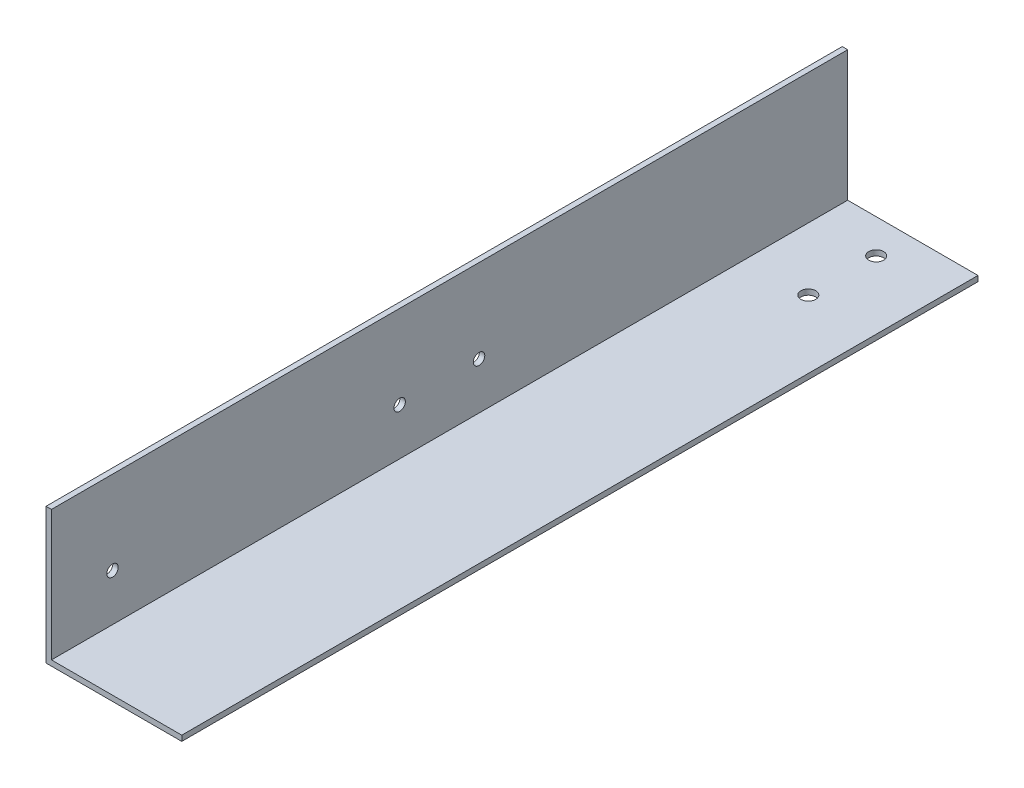
from build123d import *

# Parameters (mm, degrees)
BOSS_EXTRUDE1_DEPTH = 293.25
SKETCH2_R           = 2.1
CUT_EXTRUDE1_DEPTH  = 5
SKETCH3_R           = 2.75
CUT_EXTRUDE2_DEPTH  = 5


with BuildPart() as part:
    # Sketch1 → Boss-Extrude1 (new body)
    with BuildSketch(Plane.XY):
        Polygon((0, 0), (50, 0), (50, 2), (2, 2), (2, 50), (0, 50), align=None)
    extrude(amount=BOSS_EXTRUDE1_DEPTH)

    # Sketch2 → Cut-Extrude1 (cut, symmetric)
    with BuildSketch(Plane(origin=(0, 0, 0), x_dir=(0, 0, -1), z_dir=(1, 0, 0))):
        with Locations((-135.75, 19.25)):
            Circle(SKETCH2_R)
        with Locations((-165, 19.25)):
            Circle(SKETCH2_R)
        with Locations((-270.75, 19.25)):
            Circle(SKETCH2_R)
    extrude(amount=CUT_EXTRUDE1_DEPTH, both=True, mode=Mode.SUBTRACT)

    # Sketch3 → Cut-Extrude2 (cut, symmetric)
    with BuildSketch(Plane(origin=(0, 0, 0), x_dir=(1, 0, 0), z_dir=(0, 1, 0))):
        with Locations((25, -12.5)):
            Circle(SKETCH3_R)
        with Locations((25, -37.5)):
            Circle(SKETCH3_R)
    extrude(amount=CUT_EXTRUDE2_DEPTH, both=True, mode=Mode.SUBTRACT)


solid = part.part
